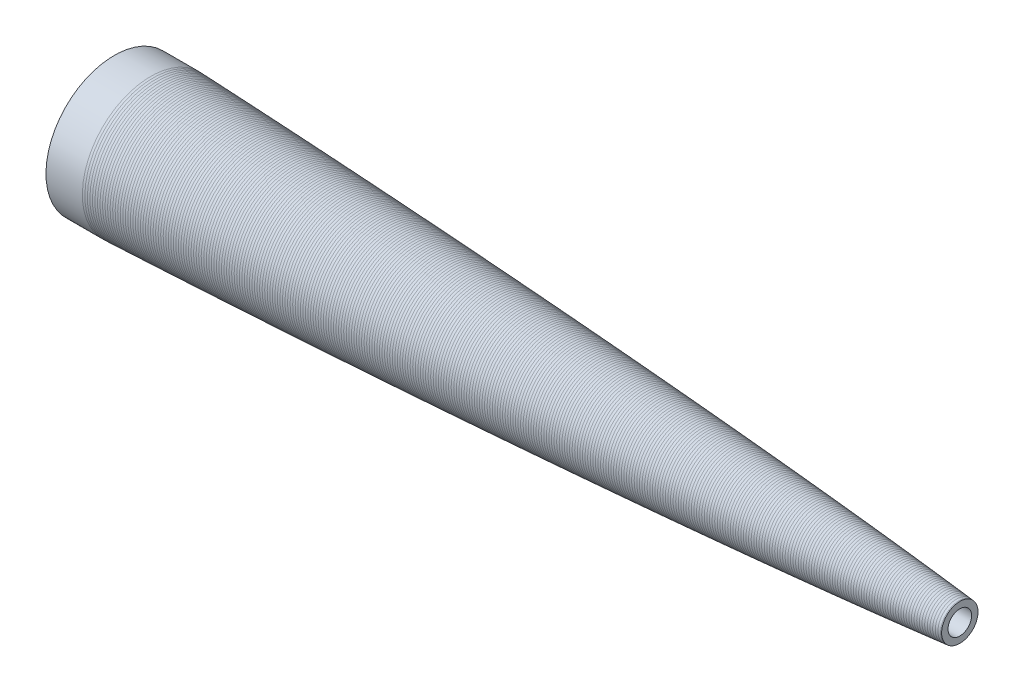
from build123d import *


# Read off the part's stored shape, not the designer's step: Shell1
with BuildPart() as part:
    # Sketch1 → Revolve1 (revolve)
    with BuildSketch(Plane.XY, mode=Mode.PRIVATE) as revolve1_sk:
        Polygon((0, 71.5001364), (2.54, 71.4029814), (5.08, 71.3054708), (7.62, 71.2076046), (10.16, 71.109332), (12.7, 71.0107292), (15.24, 70.9117454), (17.78, 70.8123806), (20.32, 70.7126602), (22.86, 70.6125842), (25.4, 70.5121526), (27.94, 70.41134), (30.48, 70.3101718), (33.02, 70.208648), (35.56, 70.1067686), (38.1, 70.0045336), (40.64, 69.9019176), (43.18, 69.7989714), (45.72, 69.6956696), (48.26, 69.5920122), (50.8, 69.4879738), (53.34, 69.3836052), (55.88, 69.278881), (58.42, 69.1738266), (60.96, 69.0683912), (63.5, 68.9626256), (66.04, 68.8565044), (68.58, 68.7500276), (71.12, 68.6432206), (73.66, 68.536058), (76.2, 68.4285398), (78.74, 68.3206914), (81.28, 68.2124874), (83.82, 68.1039532), (86.36, 67.9950634), (88.9, 67.8858434), (91.44, 67.7762678), (93.98, 67.666362), (96.52, 67.5561006), (99.06, 67.445509), (101.6, 67.3345872), (104.14, 67.2233098), (106.68, 67.1117022), (109.22, 66.999739), (111.76, 66.887471), (114.3, 66.7748474), (116.84, 66.6618936), (119.38, 66.5485842), (121.92, 66.43497), (124.46, 66.3210002), (127, 66.2067002), (129.54, 66.09207), (132.08, 65.9771096), (134.62, 65.861819), (137.16, 65.7461728), (139.7, 65.6302218), (142.24, 65.5139152), (144.78, 65.3973038), (147.32, 65.2803368), (149.86, 65.1630396), (152.4, 65.0454376), (154.94, 64.92748), (157.48, 64.8092176), (160.02, 64.6905996), (162.56, 64.5716514), (165.1, 64.4523984), (167.64, 64.3328152), (170.18, 64.2128764), (172.72, 64.0926328), (175.26, 63.972059), (177.8, 63.851155), (180.34, 63.7299208), (182.88, 63.6083564), (185.42, 63.4864872), (187.96, 63.3642624), (190.5, 63.2417328), (193.04, 63.118873), (195.58, 62.995683), (198.12, 62.8721628), (200.66, 62.7483378), (203.2, 62.6241572), (205.74, 62.4996718), (208.28, 62.3748562), (210.82, 62.2497104), (213.36, 62.1242598), (215.9, 61.998479), (218.44, 61.8723426), (220.98, 61.7459268), (223.52, 61.6191554), (226.06, 61.4920792), (228.6, 61.3646728), (231.14, 61.2369362), (233.68, 61.1088694), (236.22, 60.9804978), (238.76, 60.851796), (241.3, 60.722764), (243.84, 60.5934018), (246.38, 60.4637348), (248.92, 60.3337376), (251.46, 60.2034102), (254, 60.0727526), (256.54, 59.9417902), (259.08, 59.8104976), (261.62, 59.6788748), (264.16, 59.5469472), (266.7, 59.414664), (269.24, 59.282076), (271.78, 59.1491578), (274.32, 59.0159348), (276.86, 58.8823562), (279.4, 58.7484728), (281.94, 58.6142592), (284.48, 58.4797154), (287.02, 58.3448668), (289.56, 58.209688), (292.1, 58.074179), (294.64, 57.9383398), (297.18, 57.8021704), (299.72, 57.6656708), (302.26, 57.5288664), (304.8, 57.3917318), (307.34, 57.254267), (309.88, 57.116472), (312.42, 56.9783468), (314.96, 56.8399168), (317.5, 56.7011312), (320.04, 56.5620408), (322.58, 56.4226202), (325.12, 56.2828694), (327.66, 56.1427884), (330.2, 56.0023772), (332.74, 55.8616358), (335.28, 55.7205642), (337.82, 55.5791624), (340.36, 55.4374304), (342.9, 55.2953936), (345.44, 55.1530012), (347.98, 55.0102786), (350.52, 54.8672258), (353.06, 54.7238428), (355.6, 54.5801296), (358.14, 54.4360862), (360.68, 54.2917126), (363.22, 54.1470088), (365.76, 54.0019748), (368.3, 53.8565852), (370.84, 53.7108908), (373.38, 53.5648408), (375.92, 53.4184606), (378.46, 53.2717502), (381, 53.1246842), (383.54, 52.977288), (386.08, 52.8295616), (388.62, 52.681505), (391.16, 52.5331182), (393.7, 52.3843758), (396.24, 52.2352778), (398.78, 52.085875), (401.32, 51.9361166), (403.86, 51.7860026), (406.4, 51.6355584), (408.94, 51.484784), (411.48, 51.333654), (414.02, 51.1821684), (416.56, 51.0303526), (419.1, 50.8782066), (421.64, 50.7256796), (424.18, 50.5728478), (426.72, 50.419635), (429.26, 50.266092), (431.8, 50.1121934), (434.34, 49.9579646), (436.88, 49.8033548), (439.42, 49.6484148), (441.96, 49.4931192), (444.5, 49.337468), (447.04, 49.1814612), (449.58, 49.0251242), (452.12, 48.8684062), (454.66, 48.7113326), (457.2, 48.5539288), (459.74, 48.396144), (462.28, 48.2380036), (464.82, 48.0795076), (467.36, 47.920656), (469.9, 47.7614488), (472.44, 47.6018606), (474.98, 47.4419168), (477.52, 47.2816174), (480.06, 47.120937), (482.6, 46.959901), (485.14, 46.7985094), (487.68, 46.6367368), (490.22, 46.4746086), (492.76, 46.3120994), (495.3, 46.1492092), (497.84, 45.9859634), (500.38, 45.8223366), (502.92, 45.6583542), (505.46, 45.4939654), (508, 45.329221), (510.54, 45.1640956), (513.08, 44.9985892), (515.62, 44.8327018), (518.16, 44.6664334), (520.7, 44.499784), (523.24, 44.3327536), (525.78, 44.1653168), (528.32, 43.9975244), (530.86, 43.8293256), (533.4, 43.6607458), (535.94, 43.4917596), (538.48, 43.3223924), (541.02, 43.1526188), (543.56, 42.9824642), (546.1, 42.8119032), (548.64, 42.6409612), (551.18, 42.4696128), (553.72, 42.297858), (556.26, 42.1256968), (558.8, 41.9531292), (561.34, 41.7801806), (563.88, 41.6068002), (566.42, 41.4330134), (568.96, 41.2588202), (571.5, 41.0841952), (574.04, 40.9091892), (576.58, 40.733726), (579.12, 40.5578818), (581.66, 40.3816058), (584.2, 40.204898), (586.74, 40.0277838), (589.28, 39.8502124), (591.82, 39.6722346), (594.36, 39.493825), (596.9, 39.3149836), (599.44, 39.1357104), (601.98, 38.9560054), (604.52, 38.7758686), (607.06, 38.5952746), (609.6, 38.4142488), (612.14, 38.2327658), (614.68, 38.050851), (617.22, 37.8684536), (619.76, 37.6856498), (622.3, 37.5023634), (624.84, 37.3186198), (627.38, 37.1344444), (629.92, 36.9497864), (632.46, 36.7646458), (635, 36.5790734), (637.54, 36.3930184), (640.08, 36.2064808), (642.62, 36.019486), (645.16, 35.8320086), (647.7, 35.6440486), (650.24, 35.455606), (652.78, 35.2666808), (655.32, 35.0772476), (657.86, 34.8873318), (660.4, 34.6969334), (662.94, 34.506027), (665.48, 34.3146126), (668.02, 34.1227156), (670.56, 33.9302852), (673.1, 33.7373722), (675.64, 33.5439258), (678.18, 33.349946), (680.72, 33.1554836), (683.26, 32.9604624), (685.8, 32.7649332), (688.34, 32.5688452), (690.88, 32.3722492), (693.42, 32.1750944), (695.96, 31.9774062), (698.5, 31.7791592), (701.04, 31.5803534), (703.58, 31.3810142), (706.12, 31.1810908), (708.66, 30.9806086), (711.2, 30.7795676), (713.74, 30.5779424), (716.28, 30.375733), (718.82, 30.1729394), (721.36, 29.9695616), (723.9, 29.7655996), (726.44, 29.561028), (728.98, 29.3558468), (731.52, 29.150056), (734.06, 28.943681), (736.6, 28.7366456), (739.14, 28.5290006), (741.68, 28.3207206), (744.22, 28.111831), (746.76, 27.9022556), (749.3, 27.6920706), (751.84, 27.4811998), (754.38, 27.2696686), (756.92, 27.057477), (759.46, 26.844625), (762, 26.6310618), (764.54, 26.4168382), (767.08, 26.2019034), (769.62, 25.9862574), (772.16, 25.7699002), (774.7, 25.5528318), (777.24, 25.3350522), (779.78, 25.1165106), (782.32, 24.8972324), (784.86, 24.6772176), (787.4, 24.4564408), (789.94, 24.2348766), (792.48, 24.0125504), (795.02, 23.7894114), (797.56, 23.5655104), (800.1, 23.3407712), (802.64, 23.1152192), (805.18, 22.8888544), (807.72, 22.661626), (810.26, 22.4335594), (812.8, 22.2046292), (815.34, 21.9748354), (817.88, 21.7441526), (820.42, 21.5125554), (822.96, 21.2800692), (825.5, 21.0466686), (828.04, 20.8096612), (830.58, 20.5743048), (833.12, 20.3379578), (835.66, 20.1006456), (838.2, 19.8623174), (840.74, 19.6229732), (843.28, 19.382613), (845.82, 19.141186), (846.775027231, 19.05), (846.775027231, 12.319), (821.375027231, 12.319), (821.375027231, 0), (-38.1, 0), (-38.1, 71.5001364), align=None)
    revolve(revolve1_sk.sketch.rotate(Axis((-38.1, 0, 0), (1, 0, 0)), 180), axis=Axis((-38.1, 0, 0), (1, 0, 0)))

    # Shell1 outline → Shell1 (revolve, cut)
    with BuildSketch(Plane.YX):
        Polygon((16.221796289, 842.980228156), (16.162884387, 843.600027231), (15.494, 843.600027231), (15.494, 818.200027231), (0, 818.200027231), (0, -38.1), (68.3251364, -38.1), (68.3251364, -0.060699681), (68.230309949, 2.418423231), (68.132816375, 4.957979711), (68.034968484, 7.49750452), (67.936713656, 10.037045177), (67.838128073, 12.57660168), (67.73916279, 15.116126513), (67.639815959, 17.655667192), (67.54011297, 20.195223718), (67.440054442, 22.734780251), (67.339641003, 25.274320954), (67.238846632, 27.813861664), (67.137696094, 30.35341822), (67.036190019, 32.892974783), (66.934328405, 35.432531354), (66.83211189, 37.972072095), (66.729513804, 40.511628681), (66.626584933, 43.05120111), (66.523301166, 45.590757711), (66.419662507, 48.130298483), (66.315642268, 50.6698551), (66.211291236, 53.209427558), (66.106584663, 55.749000023), (66.001548601, 58.288556662), (65.896131604, 60.828113308), (65.790383806, 63.367685795), (65.684281129, 65.907242457), (65.577822249, 68.446814959), (65.471033225, 70.986387468), (65.363889329, 73.525944153), (65.256389224, 76.065516677), (65.148558974, 78.605089209), (65.040373184, 81.144661748), (64.931857249, 83.684234294), (64.822985774, 86.223806848), (64.713784153, 88.763379409), (64.604226993, 91.302951977), (64.494339688, 93.842524554), (64.384096842, 96.382097137), (64.273523162, 98.921685558), (64.162620026, 101.461258156), (64.051361351, 104.000830762), (63.93977253, 106.540403376), (63.827827471, 109.079991826), (63.715577661, 111.619580282), (63.602973011, 114.159152918), (63.490038215, 116.698725562), (63.376747173, 119.23831404), (63.26315138, 121.777902526), (63.149200755, 124.317475193), (63.034919272, 126.857063693), (62.920307643, 129.396652201), (62.805365867, 131.936240716), (62.690094662, 134.475813412), (62.574467196, 137.015401942), (62.458534979, 139.554990479), (62.34224722, 142.094579024), (62.22565471, 144.634167576), (62.108707385, 147.17374031), (61.991428454, 149.713344701), (61.873845503, 152.252933275), (61.75590701, 154.792521856), (61.637663765, 157.332110445), (61.519065716, 159.871683218), (61.400136041, 162.411287645), (61.280901613, 164.950892079), (61.161338526, 167.490464876), (61.041419151, 170.030053502), (60.921194276, 172.569657957), (60.800640003, 175.109246599), (60.679755583, 177.648835247), (60.558541017, 180.188423904), (60.436995546, 182.728028389), (60.315146082, 185.26761706), (60.192941074, 187.807205739), (60.070430553, 190.346810246), (59.947590648, 192.88639894), (59.824420596, 195.425987642), (59.700919628, 197.96559217), (59.577114678, 200.505180888), (59.452954185, 203.044769613), (59.328488166, 205.584374164), (59.203692775, 208.123962904), (59.078566458, 210.66356747), (58.953135388, 213.203172043), (58.827375736, 215.74274499), (58.701258972, 218.282349578), (58.574862851, 220.821954174), (58.448111975, 223.361542961), (58.321055556, 225.901147571), (58.193669782, 228.440736374), (58.065953861, 230.980325185), (57.937906995, 233.519929818), (57.809555377, 236.059534459), (57.68087441, 238.599123294), (57.551863297, 241.138712136), (57.422521232, 243.6783168), (57.292874413, 246.217921472), (57.162898255, 248.757510338), (57.03259195, 251.297099213), (56.901954684, 253.836703908), (56.771012666, 256.37630861), (56.639741316, 258.915897509), (56.508138999, 261.455502227), (56.376232751, 263.995091142), (56.24397096, 266.534680065), (56.111403592, 269.074284807), (55.978506076, 271.613889557), (55.845304635, 274.153478505), (55.711747652, 276.693067461), (55.577885085, 279.232672234), (55.443693203, 281.772261207), (55.309170338, 284.311865996), (55.174342719, 286.851470793), (55.039185792, 289.391059791), (54.903698719, 291.930648797), (54.767881498, 294.470237811), (54.631734131, 297.009826834), (54.495255767, 299.549431672), (54.35847265, 302.089036518), (54.221360237, 304.628625566), (54.083917678, 307.168214623), (53.946144971, 309.707803688), (53.808041257, 312.247408567), (53.669633652, 314.78699765), (53.530870504, 317.326586741), (53.39180174, 319.866191644), (53.252403694, 322.405780753), (53.112675501, 324.94536987), (52.97261716, 327.484958996), (52.832228673, 330.024548131), (52.691510038, 332.564137274), (52.550461257, 335.103726426), (52.409082328, 337.643315588), (52.267372371, 340.182920559), (52.125358544, 342.722509738), (51.98299006, 345.262083125), (51.840290543, 347.801672323), (51.697260879, 350.341261529), (51.553901068, 352.880850744), (51.410211109, 355.420439968), (51.266191004, 357.960029201), (51.121840751, 360.499618443), (50.977160352, 363.039207694), (50.832150707, 365.578781157), (50.686784617, 368.118370427), (50.541113776, 370.657959706), (50.3950883, 373.197533198), (50.248731769, 375.737122496), (50.102046003, 378.276696007), (49.955004696, 380.816269528), (49.807632328, 383.355858854), (49.659929812, 385.89544819), (49.511897149, 388.435037535), (49.363535262, 390.974611095), (49.214818758, 393.514168871), (49.065744862, 396.053758245), (48.916366215, 398.593347629), (48.766633886, 401.132905436), (48.616545086, 403.672479047), (48.466125205, 406.21206846), (48.315376114, 408.75164209), (48.164272422, 411.29119994), (48.012812249, 413.830773592), (47.861020988, 416.370363044), (47.708901471, 418.909920926), (47.556400071, 421.449494608), (47.403593922, 423.989068301), (47.250407789, 426.528626216), (47.096890558, 429.06819993), (46.943017786, 431.607773654), (46.788815827, 434.147331601), (46.634232934, 436.68688956), (46.479318935, 439.226463317), (46.32405036, 441.766021297), (46.168426246, 444.305579289), (46.012445624, 446.845153078), (45.856135828, 449.384711093), (45.699446072, 451.924253334), (45.542398827, 454.463827156), (45.385022415, 457.003385204), (45.227266049, 459.542927481), (45.069153163, 462.082485553), (44.910684739, 464.622043637), (44.751860775, 467.161601732), (44.592682262, 469.701144057), (44.433122817, 472.240686394), (44.273206842, 474.780244525), (44.112936323, 477.319786887), (43.952284873, 479.859329262), (43.791276885, 482.398887428), (43.629914361, 484.938429828), (43.468170905, 487.477972239), (43.306071912, 490.017514664), (43.143592996, 492.557041323), (42.980732139, 495.096583774), (42.817515745, 497.636126237), (42.653918418, 500.175668713), (42.489966574, 502.715195425), (42.325608404, 505.254722151), (42.160893677, 507.794264666), (41.995799042, 510.33379142), (41.830323478, 512.873318187), (41.664466984, 515.412844968), (41.49822956, 517.952371763), (41.331611206, 520.491898571), (41.16461296, 523.031409622), (40.99720735, 525.570936458), (40.829446207, 528.11046331), (40.661279782, 530.649974404), (40.49273243, 533.189485513), (40.323778755, 535.728996637), (40.154444152, 538.268507776), (39.984703226, 540.808018931), (39.814581373, 543.3475301), (39.644053197, 545.887041285), (39.473144093, 548.426552485), (39.30182973, 550.966047933), (39.130109047, 553.505543397), (38.957982043, 556.045038878), (38.785447648, 558.58455014), (38.612533399, 561.124045654), (38.43918851, 563.663525419), (38.265436225, 566.203020965), (38.0912787, 568.742500764), (37.916688379, 571.281996344), (37.741718218, 573.821476179), (37.56629095, 576.36095603), (37.390481668, 578.900451661), (37.214242857, 581.439915788), (37.03757124, 583.979395693), (36.860494404, 586.518859856), (36.682960463, 589.058324038), (36.505019102, 591.597803998), (36.326647135, 594.137268218), (36.147843458, 596.676732457), (35.968608071, 599.216196715), (35.788940973, 601.755660993), (35.608843283, 604.295109534), (35.42828849, 606.834558095), (35.24730199, 609.374006678), (35.065858387, 611.91345528), (34.883984205, 614.45288815), (34.701626398, 616.992336794), (34.518862277, 619.531785459), (34.335617933, 622.071202642), (34.151914214, 624.61065135), (33.967779929, 627.150084328), (33.78316544, 629.689485829), (33.598066166, 632.228918853), (33.412535188, 634.768351899), (33.226524023, 637.307753472), (33.040029213, 639.847170817), (32.853077306, 642.386588185), (32.665644071, 644.925989832), (32.477728347, 647.465391503), (32.289330135, 650.0047932), (32.100450606, 652.544179178), (31.911063198, 655.083565182), (31.721192127, 657.622966956), (31.530839749, 660.162353013), (31.339980674, 662.701723356), (31.148612536, 665.241109467), (30.956763103, 667.780479866), (30.764380399, 670.319850294), (30.571515213, 672.859220749), (30.378119154, 675.398559759), (30.184187428, 677.937930273), (29.989774424, 680.47728508), (29.794803968, 683.016624182), (29.599325641, 685.555963316), (29.403288657, 688.095302482), (29.206743804, 690.63464168), (29.009641514, 693.173965177), (28.812005963, 695.713288709), (28.613812987, 698.252596543), (28.415060129, 700.791920143), (28.215775244, 703.331228048), (28.015907554, 705.87052026), (27.815479976, 708.409828237), (27.614494991, 710.949120523), (27.412927215, 713.488397121), (27.210775402, 716.027673759), (27.008039552, 718.566950436), (26.804719665, 721.106227153), (26.600817004, 723.645488187), (26.396306183, 726.184733542), (26.19118594, 728.72397894), (25.985455001, 731.263240101), (25.779142582, 733.802469868), (25.572171241, 736.341683962), (25.3645892, 738.880913821), (25.156372348, 741.420143725), (24.947548662, 743.959342247), (24.738039388, 746.498540818), (24.527920702, 749.03773944), (24.317119037, 751.576906689), (24.105655875, 754.116089703), (23.893532522, 756.65527277), (23.680751609, 759.194424473), (23.467259729, 761.733576232), (23.253107665, 764.27272805), (23.038247291, 766.811848513), (22.822675958, 769.350969039), (22.606393667, 771.890089628), (22.389400416, 774.429210279), (22.171698898, 776.968299591), (21.953236999, 779.50737327), (21.734037407, 782.046462719), (21.514102833, 784.585536538), (21.293409259, 787.124579035), (21.071928575, 789.663621608), (20.849687546, 792.202648563), (20.626634021, 794.741675597), (20.402820164, 797.280687019), (20.178171203, 799.819667143), (19.952708367, 802.358663043), (19.726435841, 804.897627655), (19.499301462, 807.436576671), (19.271329221, 809.975525781), (19.042495143, 812.514459303), (18.812799237, 815.053377241), (18.582217549, 817.59226392), (18.350721852, 820.131150705), (18.118337534, 822.670037598), (17.885193313, 825.207247535), (17.648298521, 827.746040722), (17.412904366, 830.286448174), (17.176669647, 832.825241503), (16.939471638, 835.364019294), (16.701261046, 837.902765883), (16.462034941, 840.441512612), align=None)
    revolve(axis=Axis((0, 0, 0), (1, 0, 0)), mode=Mode.SUBTRACT)


solid = part.part
